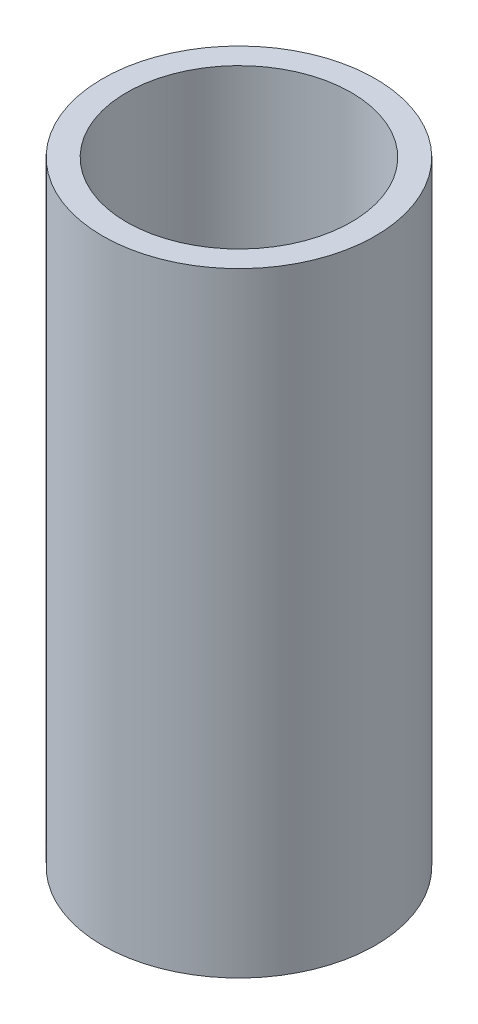
from build123d import *

# Parameters (mm, degrees)
SKETCH1_R           = 37.5
BOSS_EXTRUDE1_DEPTH = 168.980564982
SKETCH2_R           = 30.890234199
CUT_EXTRUDE1_DEPTH  = 178.107118269


with BuildPart() as part:
    # Sketch1 → Boss-Extrude1 (new body)
    with BuildSketch(Plane(origin=(0, 0, 0), x_dir=(1, 0, 0), z_dir=(0, 1, 0))):
        Circle(SKETCH1_R)
    extrude(amount=BOSS_EXTRUDE1_DEPTH)

    # Sketch2 → Cut-Extrude1 (cut, through all)
    with BuildSketch(Plane(origin=(0, 0, 0), x_dir=(1, 0, 0), z_dir=(0, 1, 0))):
        Circle(SKETCH2_R)
    extrude(amount=CUT_EXTRUDE1_DEPTH, mode=Mode.SUBTRACT)


solid = part.part
